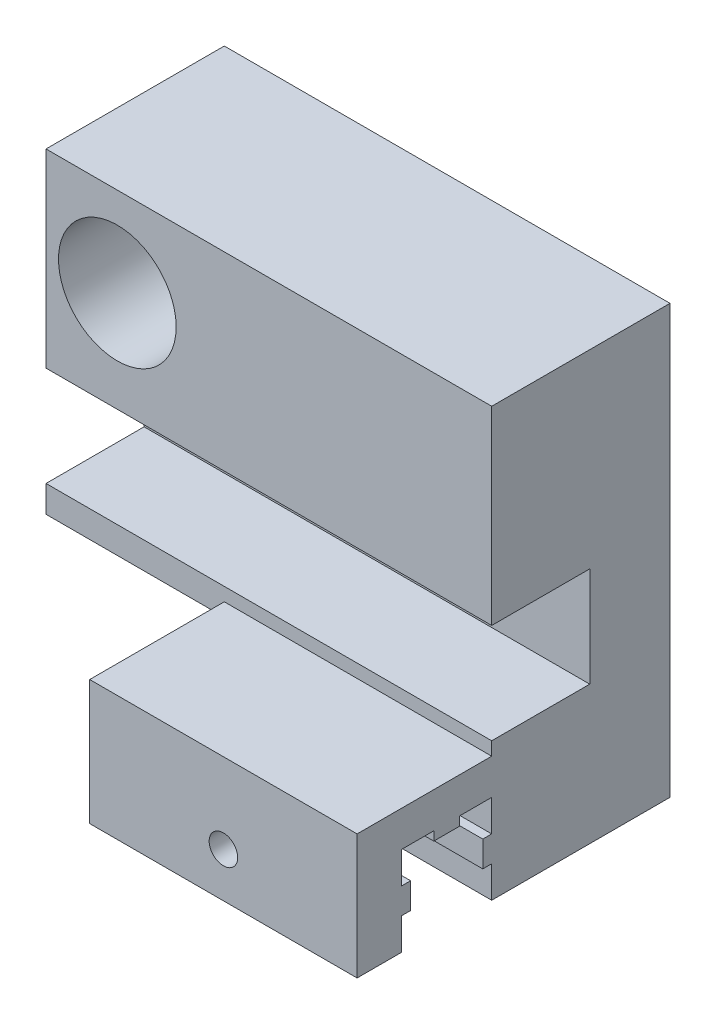
from build123d import *

# Parameters (mm, degrees)
ESQUISSE1_W             = 50
ESQUISSE1_H             = 35
MAIN_EXTRUSION_DEPTH    = 20
ESQUISSE5_R             = 1.6
GEAR_LINEAR_HOLES_DEPTH = 37.486298798
FIXING_EXTRUSION_DEPTH  = 25
ESQUISSE12_R            = 6.6
ENL_V_MAT_EXTRU_6_DEPTH = 10
ESQUISSE13_W            = 50
ESQUISSE13_H            = 11.2
ENL_V_MAT_EXTRU_7_DEPTH = 11
ENL_V_MAT_EXTRU_8_DEPTH = 20
ESQUISSE15_R            = 1.6
ENL_V_MAT_EXTRU_9_DEPTH = 53.79450729


with BuildPart() as part:
    # Esquisse1 → Main Extrusion (new body)
    with BuildSketch(Plane.XY):
        Rectangle(ESQUISSE1_W, ESQUISSE1_H)
    extrude(amount=MAIN_EXTRUSION_DEPTH)

    # Esquisse5 → Gear Linear Holes (cut, through all)
    with BuildSketch(Plane.XY.offset(20)):
        with Locations((-17, 7.5)):
            Circle(ESQUISSE5_R)
    extrude(amount=-GEAR_LINEAR_HOLES_DEPTH, mode=Mode.SUBTRACT)

    # Esquisse8 → Fixing Extrusion (add, symmetric)
    with BuildSketch(Plane(origin=(0, 0, 0), x_dir=(0, 0, -1), z_dir=(1, 0, 0))):
        Polygon((-20, -20.5), (-20, -24.05), (-21, -24.05), (-21, -26.95), (-20, -26.95), (-20, -30.5), (0, -30.5), (0, -16.5), (-35.1, -16.5), (-35.1, -30.5), (-30.1, -30.5), (-30.1, -26.95), (-29.1, -26.95), (-29.1, -24.05), (-30.1, -24.05), (-30.1, -20.5), (-26.5, -20.5), (-26.5, -21.5), (-23.6, -21.5), (-23.6, -20.5), align=None)
    extrude(amount=FIXING_EXTRUSION_DEPTH, both=True)

    # Esquisse12 → Enlèv. mat.-Extru.6 (cut)
    with BuildSketch(Plane.XY.offset(20)):
        with Locations((-17, 7.5)):
            Circle(ESQUISSE12_R)
    extrude(amount=-ENL_V_MAT_EXTRU_6_DEPTH, mode=Mode.SUBTRACT)

    # Esquisse13 → Enlèv. mat.-Extru.7 (cut)
    with BuildSketch(Plane.XY.offset(20)):
        with Locations((0, -9.4)):
            Rectangle(ESQUISSE13_W, ESQUISSE13_H)
    extrude(amount=-ENL_V_MAT_EXTRU_7_DEPTH, mode=Mode.SUBTRACT)

    # Esquisse14 → Enlèv. mat.-Extru.8 (cut)
    with BuildSketch(Plane.ZY.offset(25)):
        Polygon((0, -18), (20, -18), (20, -15), (35.1, -15), (35.1, -30.5), (0, -30.5), align=None)
    extrude(amount=-ENL_V_MAT_EXTRU_8_DEPTH, mode=Mode.SUBTRACT)

    # Esquisse15 → Enlèv. mat.-Extru.9 (cut, through all)
    with BuildSketch(Plane.XY.offset(35.1)):
        with Locations((10, -25.5)):
            Circle(ESQUISSE15_R)
    extrude(amount=-ENL_V_MAT_EXTRU_9_DEPTH, mode=Mode.SUBTRACT)


solid = part.part
